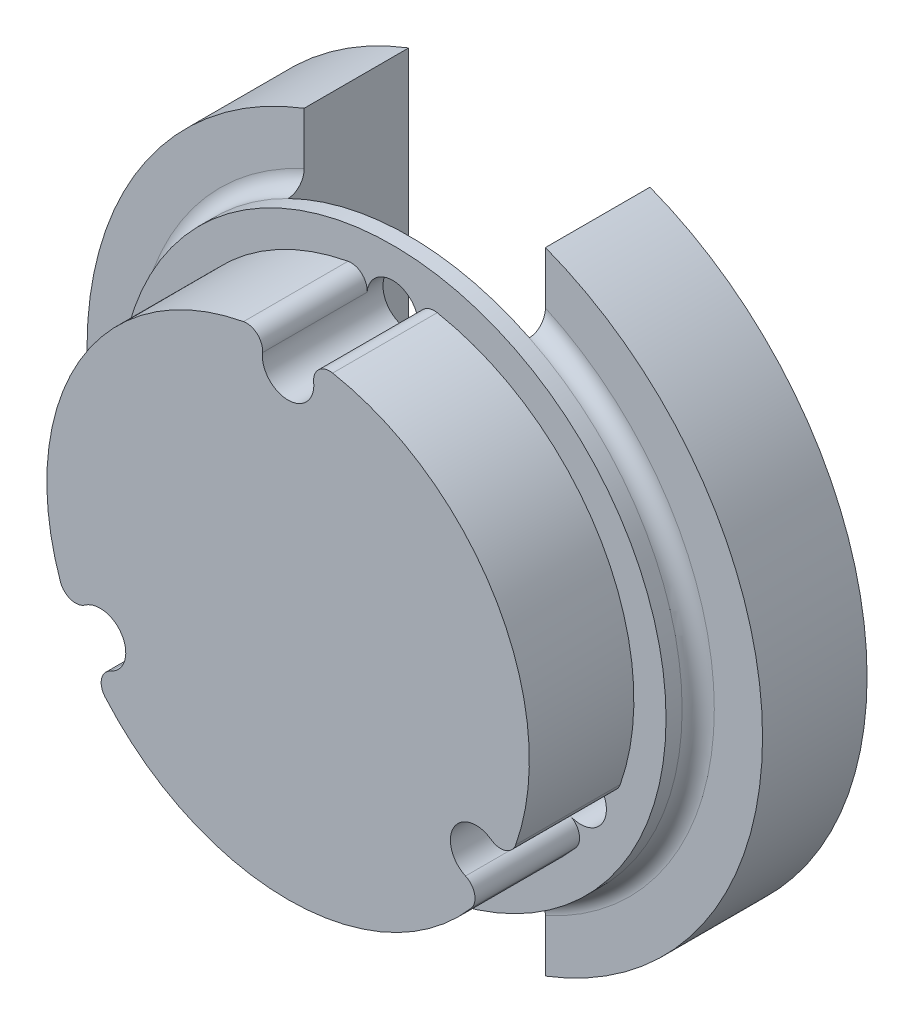
from build123d import *

# Parameters (mm, degrees)
SKETCH_1_R          = 15
EXTRUDE_1_DEPTH     = 6.5
SKETCH_2_R          = 21
EXTRUDE_2_DEPTH     = 8.5
SKETCH_3_R          = 1.6
CUT_EXTRUDE_1_DEPTH = 26.5
SKETCH_6_W          = 15
SKETCH_6_H          = 50
CUT_EXTRUDE_3_DEPTH = 7.5
FILLET_1_R          = 1
SKETCH_7_R          = 21
SKETCH_7_R_2        = 17
CUT_EXTRUDE_4_DEPTH = 2
FILLET_2_R          = 1


with BuildPart() as part:
    # 草图1 → 凸台-拉伸1 (new body)
    with BuildSketch(Plane.XY):
        with Locations(Location((0, 0, 0), (0, 0, 180))):
            Circle(SKETCH_1_R)
    extrude(amount=EXTRUDE_1_DEPTH)

    # 草图2 → 凸台-拉伸2 (add)
    with BuildSketch(Plane(origin=(0, 0, 0), x_dir=(-1, 0, 0), z_dir=(0, 0, -1))):
        Circle(SKETCH_2_R)
    extrude(amount=EXTRUDE_2_DEPTH)

    # 草图3 → 切除-拉伸1 (cut)
    with BuildSketch(Plane(origin=(0, 0, -8.5), x_dir=(-1, 0, 0), z_dir=(0, 0, -1))):
        with Locations((0, 13.5)):
            Circle(SKETCH_3_R)
        with Locations((11.691342951, -6.75)):
            Circle(SKETCH_3_R)
        with Locations((-11.691342951, -6.75)):
            Circle(SKETCH_3_R)
    extrude(amount=-CUT_EXTRUDE_1_DEPTH, mode=Mode.SUBTRACT)

    # 草图6 → 切除-拉伸3 (cut)
    with BuildSketch(Plane(origin=(0, 0, -8.5), x_dir=(-1, 0, 0), z_dir=(0, 0, -1))):
        Rectangle(SKETCH_6_W, SKETCH_6_H)
    extrude(amount=-CUT_EXTRUDE_3_DEPTH, mode=Mode.SUBTRACT)

    # 圆角1
    # the kernel refuses this fillet: 1 mm, written as the material it takes off along each edge
    with BuildSketch(Plane(origin=(-0.586781578, 14.988518519, 11.997469711), x_dir=(-0.6032076462892466, -0.7975841870662852, 0), z_dir=(0, 0, -1)), Plane(origin=(-12.687047013, -8.002427012, 11.997469711), x_dir=(0.9923319908008487, -0.1236010519098617, 0), z_dir=(0, 0, -1)), Plane(origin=(13.273828591, -6.986091506, 11.997469711), x_dir=(-0.38912434451096145, 0.9211852389768925, 0), z_dir=(0, 0, -1))) as fillet_1_piece_1:
        with BuildLine():
            CenterArc((2.187327708, 0.853683412), FILLET_1_R, 132.251057191, 106.363529617)
            ThreePointArc((1.514947242, 1.593889134), (0.728226426, 0.824743212), (0, 0))
            ThreePointArc((0, 0), (0.833267698, 0.23410654), (1.666535396, 0))
        make_face()
    extrude(amount=11.997469711, mode=Mode.SUBTRACT)
    with BuildSketch(Plane(origin=(0.586781578, 14.988518519, 11.997469711), x_dir=(0.6032076462892473, -0.7975841870662848, 0), z_dir=(0, 0, -1))) as fillet_1_piece_2:
        with BuildLine():
            CenterArc((2.187327708, -0.853683412), FILLET_1_R, 121.385413192, 106.363529617)
            ThreePointArc((1.514947242, -1.593889134), (0.728226426, -0.824743212), (0, 0))
            ThreePointArc((0, 0), (0.833267698, -0.23410654), (1.666535396, 0))
        make_face()
    extrude(amount=11.997469711, mode=Mode.SUBTRACT)
    with BuildSketch(Plane(origin=(-13.273828591, -6.986091506, 11.997469711), x_dir=(-0.3996221607245731, 0.9166799488686461, 0), z_dir=(0, 0, -1)), Plane(origin=(12.687047013, -8.002427012, 11.997469711), x_dir=(-0.594057042497704, -0.8044229175370883, 0), z_dir=(0, 0, -1))) as fillet_1_piece_3:
        with BuildLine():
            CenterArc((2.125688288, 0.997309966), FILLET_1_R, 167.839997769, 106.363529617)
            ThreePointArc((1.148125108, 1.207952385), (0.743749651, 0.442693331), (0, 0))
            ThreePointArc((0, 0), (1.099493942, -0.040350503), (2.198987885, 0))
        make_face()
    extrude(amount=11.997469711, mode=Mode.SUBTRACT)

    # 草图7 → 切除-拉伸4 (cut)
    with BuildSketch(Plane.XY):
        Circle(SKETCH_7_R)
        Circle(SKETCH_7_R_2, mode=Mode.SUBTRACT)
    extrude(amount=-CUT_EXTRUDE_4_DEPTH, mode=Mode.SUBTRACT)

    # 圆角2
    fillet_2_edges = [part.edges().sort_by_distance(p)[0] for p in [
        (-17, 0, -2),
        (14.43086969, -8.986100378, -2),
    ]]
    fillet(fillet_2_edges, radius=FILLET_2_R)


solid = part.part
